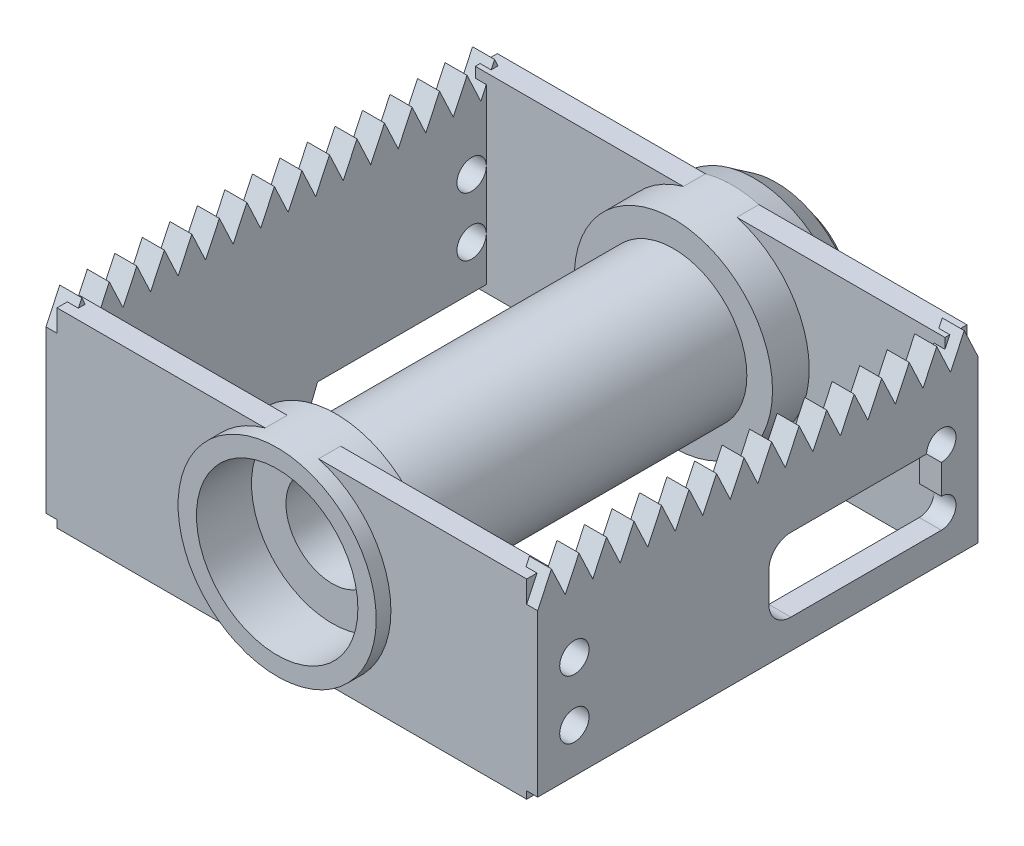
from build123d import *

# Parameters (mm, degrees)
PLACA_DELANTERA_START               = -206
PLACA_DELANTERA_DEPTH               = 3
AGUJERO_PLACA_DELANTERA_1_PROFILE_R = 2
AGUJERO_PLACA_DELANTERA_2_PROFILE_R = 2
AGUJERO_PLACA_DELANTERA_3_PROFILE_R = 2
AGUJERO_PLACA_DELANTERA_4_PROFILE_R = 2
PLACA_TRASERA_START                 = -142
PLACA_TRASERA_DEPTH                 = 3
AGUJERO_PLACA_TRASERA_1_PROFILE_R   = 2
AGUJERO_PLACA_TRASERA_2_PROFILE_R   = 2
AGUJERO_PLACA_TRASERA_3_PROFILE_R   = 2
AGUJERO_PLACA_TRASERA_4_PROFILE_R   = 2
MARCO_INTERIOR_START                = -86
SK_MARCO_INTERIOR_W                 = 64
SK_MARCO_INTERIOR_H                 = 26
SK_MARCO_INTERIOR_R                 = 11
MARCO_INTERIOR_DEPTH                = 3
MARCO_EXTERIOR_START                = -143
SK_MARCO_EXTERIOR_W                 = 64
SK_MARCO_EXTERIOR_H                 = 26
SK_MARCO_EXTERIOR_R                 = 11
MARCO_EXTERIOR_DEPTH                = 3
CORTAR_EXTRUIR2_DEPTH               = 10


with BuildPart() as part:
    # Sk_Eje_cuerpo → Eje_cuerpo (revolve)
    with BuildSketch(Plane(origin=(0, 0, 0), x_dir=(1, 0, 0), z_dir=(0, 1, 0))):
        Polygon((-183.5, 84), (-186, 84), (-186, 92), (-182.5, 92), (-182.5, 138), (-186, 138), (-186, 146), (-185.3, 149), (-183.3, 152), (-180, 154.5), (-176.5, 155.7), (-172.5, 156), (-172.5, 147), (-183.5, 147), (-183.5, 138.5), (-178.8, 138.5), (-178.8, 91.5), (-183.5, 91.5), align=None)
    revolve(axis=Axis((-172.5, 0, -62.1), (0, 0, -1)))



with BuildPart() as body_2:
    # Sk_Placa_delantera → Placa_delantera (new body)
    with BuildSketch(Plane(origin=(0, 0, 0), x_dir=(0, 0, -1), z_dir=(1, 0, 0)).offset(PLACA_DELANTERA_START)):
        Polygon((86, -12), (112, -12), (116, -22), (120, -12), (146, -12), (146, 10), (144.125, 14), (142.25, 10), (140.375, 14), (138.5, 10), (136.625, 14), (134.75, 10), (132.875, 14), (131, 10), (129.125, 14), (127.25, 10), (125.375, 14), (123.5, 10), (121.625, 14), (119.75, 10), (117.875, 14), (116, 10), (114.125, 14), (112.25, 10), (110.375, 14), (108.5, 10), (106.625, 14), (104.75, 10), (102.875, 14), (101, 10), (99.125, 14), (97.25, 10), (95.375, 14), (93.5, 10), (91.625, 14), (89.75, 10), (87.875, 14), (86, 10), align=None)
    extrude(amount=PLACA_DELANTERA_DEPTH)

    # Agujero_Placa_delantera_1: sweep along a curve in space
    with BuildLine() as agujero_placa_delantera_1_path:
        Line((-201.5, -6, -91), (-207.5, -6, -91))
    # Agujero_Placa_delantera_1 profile (on start of the path) → Agujero_Placa_delantera_1 (sweep, cut)
    with BuildSketch(Plane(origin=(-201.5, -6, -91), x_dir=(0, 0, -1), z_dir=(-1, 0, 0))):
        Circle(AGUJERO_PLACA_DELANTERA_1_PROFILE_R)
    sweep(path=agujero_placa_delantera_1_path.line, mode=Mode.SUBTRACT)

    # Agujero_Placa_delantera_2: sweep along a curve in space
    with BuildLine() as agujero_placa_delantera_2_path:
        Line((-201.5, 2, -91), (-207.5, 2, -91))
    # Agujero_Placa_delantera_2 profile (on start of the path) → Agujero_Placa_delantera_2 (sweep, cut)
    with BuildSketch(Plane(origin=(-201.5, 2, -91), x_dir=(0, 0, -1), z_dir=(-1, 0, 0))):
        Circle(AGUJERO_PLACA_DELANTERA_2_PROFILE_R)
    sweep(path=agujero_placa_delantera_2_path.line, mode=Mode.SUBTRACT)

    # Agujero_Placa_delantera_3: sweep along a curve in space
    with BuildLine() as agujero_placa_delantera_3_path:
        Line((-201.5, -6, -141), (-207.5, -6, -141))
    # Agujero_Placa_delantera_3 profile (on start of the path) → Agujero_Placa_delantera_3 (sweep, cut)
    with BuildSketch(Plane(origin=(-201.5, -6, -141), x_dir=(0, 0, -1), z_dir=(-1, 0, 0))):
        Circle(AGUJERO_PLACA_DELANTERA_3_PROFILE_R)
    sweep(path=agujero_placa_delantera_3_path.line, mode=Mode.SUBTRACT)

    # Agujero_Placa_delantera_4: sweep along a curve in space
    with BuildLine() as agujero_placa_delantera_4_path:
        Line((-201.5, 2, -141), (-207.5, 2, -141))
    # Agujero_Placa_delantera_4 profile (on start of the path) → Agujero_Placa_delantera_4 (sweep, cut)
    with BuildSketch(Plane(origin=(-201.5, 2, -141), x_dir=(0, 0, -1), z_dir=(-1, 0, 0))):
        Circle(AGUJERO_PLACA_DELANTERA_4_PROFILE_R)
    sweep(path=agujero_placa_delantera_4_path.line, mode=Mode.SUBTRACT)


with BuildPart() as body_3:
    # Sk_Placa_trasera → Placa_trasera (new body)
    with BuildSketch(Plane(origin=(0, 0, 0), x_dir=(0, 0, -1), z_dir=(1, 0, 0)).offset(PLACA_TRASERA_START)):
        Polygon((86, -12), (146, -12), (146, 10), (144.125, 14), (142.25, 10), (140.375, 14), (138.5, 10), (136.625, 14), (134.75, 10), (132.875, 14), (131, 10), (129.125, 14), (127.25, 10), (125.375, 14), (123.5, 10), (121.625, 14), (119.75, 10), (117.875, 14), (116, 10), (114.125, 14), (112.25, 10), (110.375, 14), (108.5, 10), (106.625, 14), (104.75, 10), (102.875, 14), (101, 10), (99.125, 14), (97.25, 10), (95.375, 14), (93.5, 10), (91.625, 14), (89.75, 10), (87.875, 14), (86, 10), align=None)
    extrude(amount=PLACA_TRASERA_DEPTH)

    # Agujero_Placa_trasera_1: sweep along a curve in space
    with BuildLine() as agujero_placa_trasera_1_path:
        Line((-137.5, -6, -91), (-143.5, -6, -91))
    # Agujero_Placa_trasera_1 profile (on start of the path) → Agujero_Placa_trasera_1 (sweep, cut)
    with BuildSketch(Plane(origin=(-137.5, -6, -91), x_dir=(0, 0, -1), z_dir=(-1, 0, 0))):
        Circle(AGUJERO_PLACA_TRASERA_1_PROFILE_R)
    sweep(path=agujero_placa_trasera_1_path.line, mode=Mode.SUBTRACT)

    # Agujero_Placa_trasera_2: sweep along a curve in space
    with BuildLine() as agujero_placa_trasera_2_path:
        Line((-137.5, 2, -91), (-143.5, 2, -91))
    # Agujero_Placa_trasera_2 profile (on start of the path) → Agujero_Placa_trasera_2 (sweep, cut)
    with BuildSketch(Plane(origin=(-137.5, 2, -91), x_dir=(0, 0, -1), z_dir=(-1, 0, 0))):
        Circle(AGUJERO_PLACA_TRASERA_2_PROFILE_R)
    sweep(path=agujero_placa_trasera_2_path.line, mode=Mode.SUBTRACT)

    # Agujero_Placa_trasera_3: sweep along a curve in space
    with BuildLine() as agujero_placa_trasera_3_path:
        Line((-137.5, -6, -141), (-143.5, -6, -141))
    # Agujero_Placa_trasera_3 profile (on start of the path) → Agujero_Placa_trasera_3 (sweep, cut)
    with BuildSketch(Plane(origin=(-137.5, -6, -141), x_dir=(0, 0, -1), z_dir=(-1, 0, 0))):
        Circle(AGUJERO_PLACA_TRASERA_3_PROFILE_R)
    sweep(path=agujero_placa_trasera_3_path.line, mode=Mode.SUBTRACT)

    # Agujero_Placa_trasera_4: sweep along a curve in space
    with BuildLine() as agujero_placa_trasera_4_path:
        Line((-137.5, 2, -141), (-143.5, 2, -141))
    # Agujero_Placa_trasera_4 profile (on start of the path) → Agujero_Placa_trasera_4 (sweep, cut)
    with BuildSketch(Plane(origin=(-137.5, 2, -141), x_dir=(0, 0, -1), z_dir=(-1, 0, 0))):
        Circle(AGUJERO_PLACA_TRASERA_4_PROFILE_R)
    sweep(path=agujero_placa_trasera_4_path.line, mode=Mode.SUBTRACT)


with BuildPart() as part_1:
    add(part.part)

    add(body_2.part)  # Marco_interior merges body 2

    add(body_3.part)  # Marco_interior merges body 3
    # Sk_Marco_interior → Marco_interior (add)
    with BuildSketch(Plane.XY.offset(MARCO_INTERIOR_START)):
        with Locations((-172.5, 0)):
            Rectangle(SK_MARCO_INTERIOR_W, SK_MARCO_INTERIOR_H)
        with Locations((-172.5, 0)):
            Circle(SK_MARCO_INTERIOR_R, mode=Mode.SUBTRACT)
    extrude(amount=-MARCO_INTERIOR_DEPTH)

    # Sk_Marco_exterior → Marco_exterior (add)
    with BuildSketch(Plane.XY.offset(MARCO_EXTERIOR_START)):
        with Locations((-172.5, 0)):
            Rectangle(SK_MARCO_EXTERIOR_W, SK_MARCO_EXTERIOR_H)
        with Locations((-172.5, 0)):
            Circle(SK_MARCO_EXTERIOR_R, mode=Mode.SUBTRACT)
    extrude(amount=-MARCO_EXTERIOR_DEPTH)

    # Croquis1 → Cortar-Extruir2 (cut)
    with BuildSketch(Plane(origin=(-139, 0, 0), x_dir=(0, 0, -1), z_dir=(1, 0, 0))):
        with BuildLine():
            Line((117.492022853, -1), (117.492022853, -5))
            ThreePointArc((117.492022853, -5), (118.370702509, -7.121320344), (120.492022853, -8))
            Line((120.492022853, -8), (141, -8))
            Line((141, -8), (141, 2))
            Line((141, 2), (120.492022853, 2))
            ThreePointArc((120.492022853, 2), (118.370702509, 1.121320344), (117.492022853, -1))
        make_face()
    extrude(amount=-CORTAR_EXTRUIR2_DEPTH, mode=Mode.SUBTRACT)


solid = part_1.part
